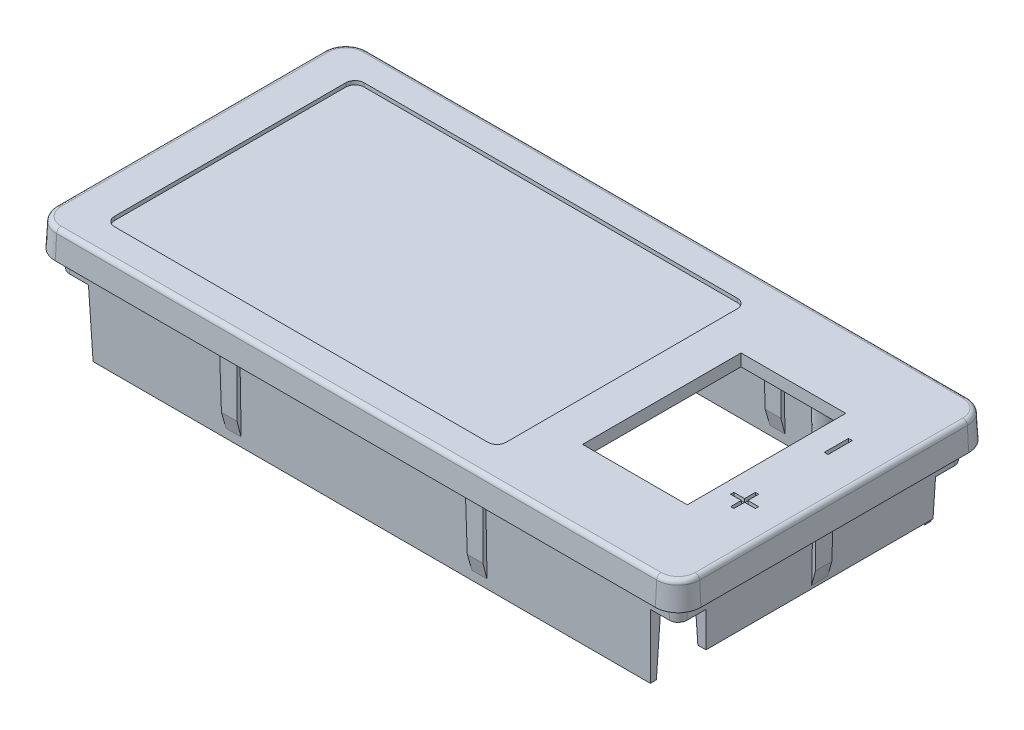
from build123d import *

# Parameters (mm, degrees)
BOSS_EXTRUDE1_DEPTH           = 3
BOSS_EXTRUDE1_TAPER           = 3
FILLET1_R                     = 0.5
CUT_EXTRUDE1_DEPTH            = 0.5
BOSS_EXTRUDE2_DEPTH           = 9.8
BOSS_EXTRUDE2_DRAFT           = 2
CUT_EXTRUDE2_DEPTH            = 1.2
CUT_EXTRUDE2_DRAFT            = -2
SKETCH7_W                     = 80
SKETCH7_H                     = 26.5
CUT_EXTRUDE3_DEPTH            = 3.3
SKETCH6_W                     = 5.700947067
SKETCH6_H                     = 5.700947067
CUT_EXTRUDE4_DEPTH            = 7.3
CUT_EXTRUDE4_DRAFT            = -2
CUT_EXTRUDE4_PROFILE_2_DEPTH  = 7.3
CUT_EXTRUDE4_PROFILE_2_DRAFT  = -2
CUT_EXTRUDE4_PROFILE_3_DEPTH  = 7.3
CUT_EXTRUDE4_PROFILE_3_DRAFT  = -2
CUT_EXTRUDE4_PROFILE_4_DEPTH  = 7.3
CUT_EXTRUDE4_PROFILE_4_DRAFT  = -2
SKETCH8_W                     = 32
SKETCH8_H                     = 2
CUT_EXTRUDE5_DEPTH            = 7.3
FILLET3_R                     = 0.5
SKETCH9_R                     = 1.5
SKETCH9_R_2                   = 0.8
BOSS_EXTRUDE3_DEPTH           = 0.6
BOSS_EXTRUDE3_DRAFT           = 2
BOSS_EXTRUDE3_PROFILE_2_DEPTH = 0.6
BOSS_EXTRUDE3_PROFILE_2_DRAFT = 2
BOSS_EXTRUDE3_PROFILE_3_DEPTH = 0.6
BOSS_EXTRUDE3_PROFILE_3_DRAFT = 2
BOSS_EXTRUDE3_PROFILE_4_DEPTH = 0.6
BOSS_EXTRUDE3_PROFILE_4_DRAFT = 2
SKETCH10_R                    = 1.75
BOSS_EXTRUDE4_DEPTH           = 1
BOSS_EXTRUDE4_DRAFT           = 2
BOSS_EXTRUDE4_PROFILE_2_DEPTH = 1
BOSS_EXTRUDE4_PROFILE_2_DRAFT = 2
BOSS_EXTRUDE4_PROFILE_3_DEPTH = 1
BOSS_EXTRUDE4_PROFILE_3_DRAFT = 2
SKETCH11_R                    = 1.25
SKETCH11_R_2                  = 0.55
BOSS_EXTRUDE5_DEPTH           = 6
BOSS_EXTRUDE5_DRAFT           = 1
BOSS_EXTRUDE5_PROFILE_2_DEPTH = 6
BOSS_EXTRUDE5_PROFILE_2_DRAFT = 1
BOSS_EXTRUDE5_PROFILE_3_DEPTH = 6
BOSS_EXTRUDE5_PROFILE_3_DRAFT = 1
SKETCH12_W                    = 11.5
SKETCH12_H                    = 17.4
CUT_EXTRUDE6_DEPTH            = 42.277506108
CUT_EXTRUDE6_DRAFT            = -1
CUT_EXTRUDE7_DEPTH            = 0.4
CUT_EXTRUDE7_DRAFT            = -2
CUT_EXTRUDE8_DEPTH            = 0.4
CUT_EXTRUDE8_DRAFT            = -1
SKETCH14_W                    = 0.41025641
SKETCH14_H                    = 2.666666666
CUT_EXTRUDE8_PROFILE_2_DEPTH  = 0.4
CUT_EXTRUDE8_PROFILE_2_DRAFT  = -1
SKETCH16_W                    = 2
SKETCH16_H                    = 2
BOSS_EXTRUDE7_DEPTH           = 10
BOSS_EXTRUDE7_DRAFT           = 1
BOSS_EXTRUDE7_PROFILE_2_DEPTH = 10
BOSS_EXTRUDE7_PROFILE_2_DRAFT = 1
BOSS_EXTRUDE7_PROFILE_3_DEPTH = 10
BOSS_EXTRUDE7_PROFILE_3_DRAFT = 1
BOSS_EXTRUDE7_PROFILE_4_DEPTH = 10
BOSS_EXTRUDE7_PROFILE_4_DRAFT = 1
SKETCH17_W                    = 1
SKETCH17_H                    = 2
BOSS_EXTRUDE8_DEPTH           = 7.5
BOSS_EXTRUDE8_DRAFT           = 1
BOSS_EXTRUDE8_PROFILE_2_DEPTH = 7.5
BOSS_EXTRUDE8_PROFILE_2_DRAFT = 1
BOSS_EXTRUDE8_PROFILE_3_DEPTH = 7.5
BOSS_EXTRUDE8_PROFILE_3_DRAFT = 1
CHAMFER1_SIZE                 = 0.45
CHAMFER1_SIZE_2               = 1.75


with BuildPart() as part:
    # Sketch1 → Boss-Extrude1 (new body)
    with BuildSketch(Plane(origin=(0, 0, 0), x_dir=(1, 0, 0), z_dir=(0, 1, 0))):
        with BuildLine():
            Line((-32.95, -17.2), (32.95, -17.2))
            ThreePointArc((32.95, -17.2), (34.717766953, -16.467766953), (35.45, -14.7))
            Line((35.45, -14.7), (35.45, 14.7))
            ThreePointArc((35.45, 14.7), (34.717766953, 16.467766953), (32.95, 17.2))
            Line((32.95, 17.2), (-32.95, 17.2))
            ThreePointArc((-32.95, 17.2), (-34.717766953, 16.467766953), (-35.45, 14.7))
            Line((-35.45, 14.7), (-35.45, -14.7))
            ThreePointArc((-35.45, -14.7), (-34.717766953, -16.467766953), (-32.95, -17.2))
        make_face()
    extrude(amount=BOSS_EXTRUDE1_DEPTH, taper=BOSS_EXTRUDE1_TAPER)

    # Fillet1
    fillet1_edges = [part.edges().sort_by_distance(p)[0] for p in [
        (34.606593265, 3, -16.356593265),
        (0, 3, -17.042776662),
        (-34.606593265, 3, -16.356593265),
        (-35.292776662, 3, 0),
        (-34.606593265, 3, 16.356593265),
        (0, 3, 17.042776662),
        (34.606593265, 3, 16.356593265),
        (35.292776662, 3, 0),
    ]]
    fillet(fillet1_edges, radius=FILLET1_R)

    # Sketch2 → Cut-Extrude1 (cut)
    with BuildSketch(Plane.XZ):
        with BuildLine():
            Line((32.95, 16.45), (-32.95, 16.45))
            ThreePointArc((-32.95, 16.45), (-34.187436867, 15.937436867), (-34.7, 14.7))
            Line((-34.7, 14.7), (-34.7, -14.7))
            ThreePointArc((-34.7, -14.7), (-34.187436867, -15.937436867), (-32.95, -16.45))
            Line((-32.95, -16.45), (32.95, -16.45))
            ThreePointArc((32.95, -16.45), (34.187436867, -15.937436867), (34.7, -14.7))
            Line((34.7, -14.7), (34.7, 14.7))
            ThreePointArc((34.7, 14.7), (34.187436867, 15.937436867), (32.95, 16.45))
        make_face()
    extrude(amount=-CUT_EXTRUDE1_DEPTH, mode=Mode.SUBTRACT)


with BuildPart() as boss_extrude2_tool:
    # Sketch4 → Boss-Extrude2 (with draft: the straight prism first)
    with BuildSketch(Plane.XZ.offset(-0.5)):
        with BuildLine():
            Line((32.95, 15.75), (-32.95, 15.75))
            ThreePointArc((-32.95, 15.75), (-33.69246212, 15.44246212), (-34, 14.7))
            Line((-34, 14.7), (-34, -14.7))
            ThreePointArc((-34, -14.7), (-33.69246212, -15.44246212), (-32.95, -15.75))
            Line((-32.95, -15.75), (32.95, -15.75))
            ThreePointArc((32.95, -15.75), (33.69246212, -15.44246212), (34, -14.7))
            Line((34, -14.7), (34, 14.7))
            ThreePointArc((34, 14.7), (33.69246212, 15.44246212), (32.95, 15.75))
        make_face()
        with BuildLine():
            Line((31.65, -14.4), (-31.65, -14.4))
            ThreePointArc((-31.65, -14.4), (-32.357106781, -14.107106781), (-32.65, -13.4))
            Line((-32.65, -13.4), (-32.65, 13.4))
            ThreePointArc((-32.65, 13.4), (-32.357106781, 14.107106781), (-31.65, 14.4))
            Line((-31.65, 14.4), (31.65, 14.4))
            ThreePointArc((31.65, 14.4), (32.357106781, 14.107106781), (32.65, 13.4))
            Line((32.65, 13.4), (32.65, -13.4))
            ThreePointArc((32.65, -13.4), (32.357106781, -14.107106781), (31.65, -14.4))
        make_face(mode=Mode.SUBTRACT)
    extrude(amount=BOSS_EXTRUDE2_DEPTH)
    # Boss-Extrude2: the draft: its side faces are tilted about the plane it starts from
    boss_extrude2_sides = [boss_extrude2_tool.faces().sort_by_distance(p)[0] for p in [
        (0, -4.4, 15.75),
        (-33.69246212, -4.4, 15.44246212),
        (-34, -4.4, 0),
        (-33.69246212, -4.4, -15.44246212),
        (0, -4.4, -15.75),
        (33.69246212, -4.4, -15.44246212),
        (34, -4.4, 0),
        (33.69246212, -4.4, 15.44246212),
        (0, -4.4, -14.4),
        (-32.357106781, -4.4, -14.107106781),
        (-32.65, -4.4, 0),
        (-32.357106781, -4.4, 14.107106781),
        (0, -4.4, 14.4),
        (32.357106781, -4.4, 14.107106781),
        (32.65, -4.4, 0),
        (32.357106781, -4.4, -14.107106781),
    ]]
    draft(boss_extrude2_sides, Plane.XZ.offset(-0.5), BOSS_EXTRUDE2_DRAFT)


with BuildPart() as part_1:
    add(part.part)

    # Boss-Extrude2: add boss_extrude2_tool
    add(boss_extrude2_tool.part)


with BuildPart() as cut_extrude2_tool:
    # Sketch5 → Cut-Extrude2 (with draft: the straight prism first)
    with BuildSketch(Plane.XZ.offset(-0.5)):
        with BuildLine():
            Line((31.65, 14.4), (-31.65, 14.4))
            ThreePointArc((-31.65, 14.4), (-32.357106781, 14.107106781), (-32.65, 13.4))
            Line((-32.65, 13.4), (-32.65, -13.4))
            ThreePointArc((-32.65, -13.4), (-32.357106781, -14.107106781), (-31.65, -14.4))
            Line((-31.65, -14.4), (31.65, -14.4))
            ThreePointArc((31.65, -14.4), (32.357106781, -14.107106781), (32.65, -13.4))
            Line((32.65, -13.4), (32.65, 13.4))
            ThreePointArc((32.65, 13.4), (32.357106781, 14.107106781), (31.65, 14.4))
        make_face()
    extrude(amount=-CUT_EXTRUDE2_DEPTH)
    # Cut-Extrude2: the draft: its side faces are tilted about the plane it starts from
    cut_extrude2_sides = [cut_extrude2_tool.faces().sort_by_distance(p)[0] for p in [
        (0, 1.1, 14.4),
        (-32.357106781, 1.1, 14.107106781),
        (-32.65, 1.1, 0),
        (-32.357106781, 1.1, -14.107106781),
        (0, 1.1, -14.4),
        (32.357106781, 1.1, -14.107106781),
        (32.65, 1.1, 0),
        (32.357106781, 1.1, 14.107106781),
    ]]
    draft(cut_extrude2_sides, Plane.XZ.offset(-0.5), CUT_EXTRUDE2_DRAFT)


with BuildPart() as part_2:
    add(part_1.part)

    # Cut-Extrude2: cut by cut_extrude2_tool
    add(cut_extrude2_tool.part, mode=Mode.SUBTRACT)

    # Sketch7 → Cut-Extrude3 (cut)
    with BuildSketch(Plane.XZ.offset(9.3)):
        Rectangle(SKETCH7_W, SKETCH7_H)
    extrude(amount=-CUT_EXTRUDE3_DEPTH, mode=Mode.SUBTRACT)


with BuildPart() as cut_extrude4_tool:
    # Sketch6 → Cut-Extrude4 (with draft: the straight prism first)
    with BuildSketch(Plane.XZ.offset(9.3)):
        with Locations((-33.450473534, 15.200473534)):
            Rectangle(SKETCH6_W, SKETCH6_H)
    extrude(amount=-CUT_EXTRUDE4_DEPTH)
    # Cut-Extrude4: the draft: its side faces are tilted about the plane it starts from
    cut_extrude4_sides = [cut_extrude4_tool.faces().sort_by_distance(p)[0] for p in [
        (-36.300947067, -5.65, 15.200473534),
        (-33.450473534, -5.65, 12.35),
        (-30.6, -5.65, 15.200473534),
        (-33.450473534, -5.65, 18.050947067),
    ]]
    draft(cut_extrude4_sides, Plane.XZ.offset(9.3), CUT_EXTRUDE4_DRAFT)


with BuildPart() as part_3:
    add(part_2.part)

    # Cut-Extrude4: cut by cut_extrude4_tool
    add(cut_extrude4_tool.part, mode=Mode.SUBTRACT)


with BuildPart() as cut_extrude4_profile_2_tool:
    # Sketch6 → Cut-Extrude4 profile 2 (with draft: the straight prism first)
    with BuildSketch(Plane.XZ.offset(9.3)):
        with Locations((33.450473534, 15.200473534)):
            Rectangle(SKETCH6_W, SKETCH6_H)
    extrude(amount=-CUT_EXTRUDE4_PROFILE_2_DEPTH)
    # Cut-Extrude4 profile 2: the draft: its side faces are tilted about the plane it starts from
    cut_extrude4_profile_2_sides = [cut_extrude4_profile_2_tool.faces().sort_by_distance(p)[0] for p in [
        (30.6, -5.65, 15.200473534),
        (33.450473534, -5.65, 12.35),
        (36.300947067, -5.65, 15.200473534),
        (33.450473534, -5.65, 18.050947067),
    ]]
    draft(cut_extrude4_profile_2_sides, Plane.XZ.offset(9.3), CUT_EXTRUDE4_PROFILE_2_DRAFT)


with BuildPart() as part_4:
    add(part_3.part)

    # Cut-Extrude4 profile 2: cut by cut_extrude4_profile_2_tool
    add(cut_extrude4_profile_2_tool.part, mode=Mode.SUBTRACT)


with BuildPart() as cut_extrude4_profile_3_tool:
    # Sketch6 → Cut-Extrude4 profile 3 (with draft: the straight prism first)
    with BuildSketch(Plane.XZ.offset(9.3)):
        with Locations((33.450473534, -15.200473534)):
            Rectangle(SKETCH6_W, SKETCH6_H)
    extrude(amount=-CUT_EXTRUDE4_PROFILE_3_DEPTH)
    # Cut-Extrude4 profile 3: the draft: its side faces are tilted about the plane it starts from
    cut_extrude4_profile_3_sides = [cut_extrude4_profile_3_tool.faces().sort_by_distance(p)[0] for p in [
        (36.300947067, -5.65, -15.200473534),
        (33.450473534, -5.65, -12.35),
        (30.6, -5.65, -15.200473534),
        (33.450473534, -5.65, -18.050947067),
    ]]
    draft(cut_extrude4_profile_3_sides, Plane.XZ.offset(9.3), CUT_EXTRUDE4_PROFILE_3_DRAFT)


with BuildPart() as part_5:
    add(part_4.part)

    # Cut-Extrude4 profile 3: cut by cut_extrude4_profile_3_tool
    add(cut_extrude4_profile_3_tool.part, mode=Mode.SUBTRACT)


with BuildPart() as cut_extrude4_profile_4_tool:
    # Sketch6 → Cut-Extrude4 profile 4 (with draft: the straight prism first)
    with BuildSketch(Plane.XZ.offset(9.3)):
        with Locations((-33.450473534, -15.200473534)):
            Rectangle(SKETCH6_W, SKETCH6_H)
    extrude(amount=-CUT_EXTRUDE4_PROFILE_4_DEPTH)
    # Cut-Extrude4 profile 4: the draft: its side faces are tilted about the plane it starts from
    cut_extrude4_profile_4_sides = [cut_extrude4_profile_4_tool.faces().sort_by_distance(p)[0] for p in [
        (-30.6, -5.65, -15.200473534),
        (-33.450473534, -5.65, -12.35),
        (-36.300947067, -5.65, -15.200473534),
        (-33.450473534, -5.65, -18.050947067),
    ]]
    draft(cut_extrude4_profile_4_sides, Plane.XZ.offset(9.3), CUT_EXTRUDE4_PROFILE_4_DRAFT)


with BuildPart() as part_6:
    add(part_5.part)

    # Cut-Extrude4 profile 4: cut by cut_extrude4_profile_4_tool
    add(cut_extrude4_profile_4_tool.part, mode=Mode.SUBTRACT)

    # Sketch8 → Cut-Extrude5 (cut)
    with BuildSketch(Plane.XZ.offset(9.3)):
        with Locations((-10.8, -15.072223541)):
            Rectangle(SKETCH8_W, SKETCH8_H)
    extrude(amount=-CUT_EXTRUDE5_DEPTH, mode=Mode.SUBTRACT)

    # Fillet3
    fillet3_edges = [part_6.edges().sort_by_distance(p)[0] for p in [
        (32.327475526, 1.7, 14.077475526),
        (32.608095077, 1.7, 0),
        (32.327475526, 1.7, -14.077475526),
        (0, 1.7, -14.358095077),
        (-32.327475526, 1.7, -14.077475526),
        (-32.608095077, 1.7, 0),
        (-32.327475526, 1.7, 14.077475526),
        (0, 1.7, 14.358095077),
    ]]
    fillet(fillet3_edges, radius=FILLET3_R)


with BuildPart() as boss_extrude3_tool:
    # Sketch9 → Boss-Extrude3 (with draft: the straight prism first)
    with BuildSketch(Plane.XZ.offset(-1.7)):
        with Locations((-30.625250689, 12.375250689)):
            Circle(SKETCH9_R)
        with Locations((-30.625250689, 12.375250689)):
            Circle(SKETCH9_R_2, mode=Mode.SUBTRACT)
    extrude(amount=BOSS_EXTRUDE3_DEPTH)
    # Boss-Extrude3: the draft: its side faces are tilted about the plane it starts from
    boss_extrude3_sides = [boss_extrude3_tool.faces().sort_by_distance(p)[0] for p in [
        (-32.125250689, 1.4, 12.375250689),
        (-31.425250689, 1.4, 12.375250689),
    ]]
    draft(boss_extrude3_sides, Plane.XZ.offset(-1.7), BOSS_EXTRUDE3_DRAFT)


with BuildPart() as part_7:
    add(part_6.part)

    # Boss-Extrude3: add boss_extrude3_tool
    add(boss_extrude3_tool.part)


with BuildPart() as boss_extrude3_profile_2_tool:
    # Sketch9 → Boss-Extrude3 profile 2 (with draft: the straight prism first)
    with BuildSketch(Plane.XZ.offset(-1.7)):
        with Locations((30.625250689, 12.375250689)):
            Circle(SKETCH9_R)
        with Locations((30.625250689, 12.375250689)):
            Circle(SKETCH9_R_2, mode=Mode.SUBTRACT)
    extrude(amount=BOSS_EXTRUDE3_PROFILE_2_DEPTH)
    # Boss-Extrude3 profile 2: the draft: its side faces are tilted about the plane it starts from
    boss_extrude3_profile_2_sides = [boss_extrude3_profile_2_tool.faces().sort_by_distance(p)[0] for p in [
        (29.125250689, 1.4, 12.375250689),
        (29.825250689, 1.4, 12.375250689),
    ]]
    draft(boss_extrude3_profile_2_sides, Plane.XZ.offset(-1.7), BOSS_EXTRUDE3_PROFILE_2_DRAFT)


with BuildPart() as part_8:
    add(part_7.part)

    # Boss-Extrude3 profile 2: add boss_extrude3_profile_2_tool
    add(boss_extrude3_profile_2_tool.part)


with BuildPart() as boss_extrude3_profile_3_tool:
    # Sketch9 → Boss-Extrude3 profile 3 (with draft: the straight prism first)
    with BuildSketch(Plane.XZ.offset(-1.7)):
        with Locations((30.625250689, -12.375250689)):
            Circle(SKETCH9_R)
        with Locations((30.625250689, -12.375250689)):
            Circle(SKETCH9_R_2, mode=Mode.SUBTRACT)
    extrude(amount=BOSS_EXTRUDE3_PROFILE_3_DEPTH)
    # Boss-Extrude3 profile 3: the draft: its side faces are tilted about the plane it starts from
    boss_extrude3_profile_3_sides = [boss_extrude3_profile_3_tool.faces().sort_by_distance(p)[0] for p in [
        (29.125250689, 1.4, -12.375250689),
        (29.825250689, 1.4, -12.375250689),
    ]]
    draft(boss_extrude3_profile_3_sides, Plane.XZ.offset(-1.7), BOSS_EXTRUDE3_PROFILE_3_DRAFT)


with BuildPart() as part_9:
    add(part_8.part)

    # Boss-Extrude3 profile 3: add boss_extrude3_profile_3_tool
    add(boss_extrude3_profile_3_tool.part)


with BuildPart() as boss_extrude3_profile_4_tool:
    # Sketch9 → Boss-Extrude3 profile 4 (with draft: the straight prism first)
    with BuildSketch(Plane.XZ.offset(-1.7)):
        with Locations((-30.625250689, -12.375250689)):
            Circle(SKETCH9_R)
        with Locations((-30.625250689, -12.375250689)):
            Circle(SKETCH9_R_2, mode=Mode.SUBTRACT)
    extrude(amount=BOSS_EXTRUDE3_PROFILE_4_DEPTH)
    # Boss-Extrude3 profile 4: the draft: its side faces are tilted about the plane it starts from
    boss_extrude3_profile_4_sides = [boss_extrude3_profile_4_tool.faces().sort_by_distance(p)[0] for p in [
        (-32.125250689, 1.4, -12.375250689),
        (-31.425250689, 1.4, -12.375250689),
    ]]
    draft(boss_extrude3_profile_4_sides, Plane.XZ.offset(-1.7), BOSS_EXTRUDE3_PROFILE_4_DRAFT)


with BuildPart() as part_10:
    add(part_9.part)

    # Boss-Extrude3 profile 4: add boss_extrude3_profile_4_tool
    add(boss_extrude3_profile_4_tool.part)


with BuildPart() as boss_extrude4_tool:
    # Sketch10 → Boss-Extrude4 (with draft: the straight prism first)
    with BuildSketch(Plane.XZ.offset(-1.7)):
        with Locations((21.95, 12.624946103)):
            Circle(SKETCH10_R)
    extrude(amount=BOSS_EXTRUDE4_DEPTH)
    # Boss-Extrude4: the draft: its side faces are tilted about the plane it starts from
    boss_extrude4_sides = [boss_extrude4_tool.faces().sort_by_distance(p)[0] for p in [
        (20.2, 1.2, 12.624946103),
    ]]
    draft(boss_extrude4_sides, Plane.XZ.offset(-1.7), BOSS_EXTRUDE4_DRAFT)


with BuildPart() as part_11:
    add(part_10.part)

    # Boss-Extrude4: add boss_extrude4_tool
    add(boss_extrude4_tool.part)


with BuildPart() as boss_extrude4_profile_2_tool:
    # Sketch10 → Boss-Extrude4 profile 2 (with draft: the straight prism first)
    with BuildSketch(Plane.XZ.offset(-1.7)):
        with Locations((21.95, -12.624946103)):
            Circle(SKETCH10_R)
    extrude(amount=BOSS_EXTRUDE4_PROFILE_2_DEPTH)
    # Boss-Extrude4 profile 2: the draft: its side faces are tilted about the plane it starts from
    boss_extrude4_profile_2_sides = [boss_extrude4_profile_2_tool.faces().sort_by_distance(p)[0] for p in [
        (20.2, 1.2, -12.624946103),
    ]]
    draft(boss_extrude4_profile_2_sides, Plane.XZ.offset(-1.7), BOSS_EXTRUDE4_PROFILE_2_DRAFT)


with BuildPart() as part_12:
    add(part_11.part)

    # Boss-Extrude4 profile 2: add boss_extrude4_profile_2_tool
    add(boss_extrude4_profile_2_tool.part)


with BuildPart() as boss_extrude4_profile_3_tool:
    # Sketch10 → Boss-Extrude4 profile 3 (with draft: the straight prism first)
    with BuildSketch(Plane.XZ.offset(-1.7)):
        with Locations((-30.874946103, 0)):
            Circle(SKETCH10_R)
    extrude(amount=BOSS_EXTRUDE4_PROFILE_3_DEPTH)
    # Boss-Extrude4 profile 3: the draft: its side faces are tilted about the plane it starts from
    boss_extrude4_profile_3_sides = [boss_extrude4_profile_3_tool.faces().sort_by_distance(p)[0] for p in [
        (-32.624946103, 1.2, 0),
    ]]
    draft(boss_extrude4_profile_3_sides, Plane.XZ.offset(-1.7), BOSS_EXTRUDE4_PROFILE_3_DRAFT)


with BuildPart() as part_13:
    add(part_12.part)

    # Boss-Extrude4 profile 3: add boss_extrude4_profile_3_tool
    add(boss_extrude4_profile_3_tool.part)


with BuildPart() as boss_extrude5_tool:
    # Sketch11 → Boss-Extrude5 (with draft: the straight prism first)
    with BuildSketch(Plane.XZ.offset(-1.7)):
        with Locations((21.95, 12.624946103)):
            Circle(SKETCH11_R)
        with Locations((21.95, 12.624946103)):
            Circle(SKETCH11_R_2, mode=Mode.SUBTRACT)
    extrude(amount=BOSS_EXTRUDE5_DEPTH)
    # Boss-Extrude5: the draft: its side faces are tilted about the plane it starts from
    boss_extrude5_sides = [boss_extrude5_tool.faces().sort_by_distance(p)[0] for p in [
        (20.7, -1.3, 12.624946103),
        (21.4, -1.3, 12.624946103),
    ]]
    draft(boss_extrude5_sides, Plane.XZ.offset(-1.7), BOSS_EXTRUDE5_DRAFT)


with BuildPart() as part_14:
    add(part_13.part)

    # Boss-Extrude5: add boss_extrude5_tool
    add(boss_extrude5_tool.part)


with BuildPart() as boss_extrude5_profile_2_tool:
    # Sketch11 → Boss-Extrude5 profile 2 (with draft: the straight prism first)
    with BuildSketch(Plane.XZ.offset(-1.7)):
        with Locations((21.95, -12.624946103)):
            Circle(SKETCH11_R)
        with Locations((21.95, -12.624946103)):
            Circle(SKETCH11_R_2, mode=Mode.SUBTRACT)
    extrude(amount=BOSS_EXTRUDE5_PROFILE_2_DEPTH)
    # Boss-Extrude5 profile 2: the draft: its side faces are tilted about the plane it starts from
    boss_extrude5_profile_2_sides = [boss_extrude5_profile_2_tool.faces().sort_by_distance(p)[0] for p in [
        (20.7, -1.3, -12.624946103),
        (21.4, -1.3, -12.624946103),
    ]]
    draft(boss_extrude5_profile_2_sides, Plane.XZ.offset(-1.7), BOSS_EXTRUDE5_PROFILE_2_DRAFT)


with BuildPart() as part_15:
    add(part_14.part)

    # Boss-Extrude5 profile 2: add boss_extrude5_profile_2_tool
    add(boss_extrude5_profile_2_tool.part)


with BuildPart() as boss_extrude5_profile_3_tool:
    # Sketch11 → Boss-Extrude5 profile 3 (with draft: the straight prism first)
    with BuildSketch(Plane.XZ.offset(-1.7)):
        with Locations((-30.874946103, 0)):
            Circle(SKETCH11_R)
        with Locations((-30.874946103, 0)):
            Circle(SKETCH11_R_2, mode=Mode.SUBTRACT)
    extrude(amount=BOSS_EXTRUDE5_PROFILE_3_DEPTH)
    # Boss-Extrude5 profile 3: the draft: its side faces are tilted about the plane it starts from
    boss_extrude5_profile_3_sides = [boss_extrude5_profile_3_tool.faces().sort_by_distance(p)[0] for p in [
        (-32.124946103, -1.3, 0),
        (-31.424946103, -1.3, 0),
    ]]
    draft(boss_extrude5_profile_3_sides, Plane.XZ.offset(-1.7), BOSS_EXTRUDE5_PROFILE_3_DRAFT)


with BuildPart() as part_16:
    add(part_15.part)

    # Boss-Extrude5 profile 3: add boss_extrude5_profile_3_tool
    add(boss_extrude5_profile_3_tool.part)


with BuildPart() as cut_extrude6_tool:
    # Sketch12 → Cut-Extrude6 (with draft: the straight prism first)
    with BuildSketch(Plane(origin=(0, 3, 0), x_dir=(1, 0, 0), z_dir=(0, 1, 0))):
        with Locations((22.2, 0)):
            Rectangle(SKETCH12_W, SKETCH12_H)
    extrude(amount=-CUT_EXTRUDE6_DEPTH)
    # Cut-Extrude6: the draft: its side faces are tilted about the plane it starts from
    cut_extrude6_sides = [cut_extrude6_tool.faces().sort_by_distance(p)[0] for p in [
        (22.2, -18.138753054, 8.7),
        (27.95, -18.138753054, 0),
        (22.2, -18.138753054, -8.7),
        (16.45, -18.138753054, 0),
    ]]
    draft(cut_extrude6_sides, Plane(origin=(0, 3, 0), x_dir=(1, 0, 0), z_dir=(0, 1, 0)), CUT_EXTRUDE6_DRAFT)


with BuildPart() as part_17:
    add(part_16.part)

    # Cut-Extrude6: cut by cut_extrude6_tool
    add(cut_extrude6_tool.part, mode=Mode.SUBTRACT)


with BuildPart() as cut_extrude7_tool:
    # Sketch13 → Cut-Extrude7 (with draft: the straight prism first)
    with BuildSketch(Plane(origin=(0, 3, 0), x_dir=(1, 0, 0), z_dir=(0, 1, 0))):
        with BuildLine():
            Line((-29.95, -13.7), (11.05, -13.7))
            ThreePointArc((11.05, -13.7), (11.757106781, -13.407106781), (12.05, -12.7))
            Line((12.05, -12.7), (12.05, 12.7))
            ThreePointArc((12.05, 12.7), (11.757106781, 13.407106781), (11.05, 13.7))
            Line((11.05, 13.7), (-29.95, 13.7))
            ThreePointArc((-29.95, 13.7), (-30.657106781, 13.407106781), (-30.95, 12.7))
            Line((-30.95, 12.7), (-30.95, -12.7))
            ThreePointArc((-30.95, -12.7), (-30.657106781, -13.407106781), (-29.95, -13.7))
        make_face()
    extrude(amount=-CUT_EXTRUDE7_DEPTH)
    # Cut-Extrude7: the draft: its side faces are tilted about the plane it starts from
    cut_extrude7_sides = [cut_extrude7_tool.faces().sort_by_distance(p)[0] for p in [
        (-9.45, 2.8, 13.7),
        (11.757106781, 2.8, 13.407106781),
        (12.05, 2.8, 0),
        (11.757106781, 2.8, -13.407106781),
        (-9.45, 2.8, -13.7),
        (-30.657106781, 2.8, -13.407106781),
        (-30.95, 2.8, 0),
        (-30.657106781, 2.8, 13.407106781),
    ]]
    draft(cut_extrude7_sides, Plane(origin=(0, 3, 0), x_dir=(1, 0, 0), z_dir=(0, 1, 0)), CUT_EXTRUDE7_DRAFT)


with BuildPart() as part_18:
    add(part_17.part)

    # Cut-Extrude7: cut by cut_extrude7_tool
    add(cut_extrude7_tool.part, mode=Mode.SUBTRACT)


with BuildPart() as cut_extrude8_tool:
    # Sketch14 → Cut-Extrude8 (with draft: the straight prism first)
    with BuildSketch(Plane(origin=(0, 3, 0), x_dir=(1, 0, 0), z_dir=(0, 1, 0))):
        Polygon((30.501865276, -4.954313792), (29.322378096, -4.954313792), (29.322378096, -5.313288151), (30.501865276, -5.313288151), (30.501865276, -6.49277533), (30.860839635, -6.49277533), (30.860839635, -5.313288151), (32.040326814, -5.313288151), (32.040326814, -4.954313792), (30.860839635, -4.954313792), (30.860839635, -3.774826612), (30.501865276, -3.774826612), align=None)
    extrude(amount=-CUT_EXTRUDE8_DEPTH)
    # Cut-Extrude8: the draft: its side faces are tilted about the plane it starts from
    cut_extrude8_sides = [cut_extrude8_tool.faces().sort_by_distance(p)[0] for p in [
        (29.912121686, 2.8, 4.954313792),
        (29.322378096, 2.8, 5.133800971),
        (29.912121686, 2.8, 5.313288151),
        (30.501865276, 2.8, 5.903031741),
        (30.681352455, 2.8, 6.49277533),
        (30.860839635, 2.8, 5.903031741),
        (31.450583224, 2.8, 5.313288151),
        (32.040326814, 2.8, 5.133800971),
        (31.450583224, 2.8, 4.954313792),
        (30.860839635, 2.8, 4.364570202),
        (30.681352455, 2.8, 3.774826612),
        (30.501865276, 2.8, 4.364570202),
    ]]
    draft(cut_extrude8_sides, Plane(origin=(0, 3, 0), x_dir=(1, 0, 0), z_dir=(0, 1, 0)), CUT_EXTRUDE8_DRAFT)


with BuildPart() as part_19:
    add(part_18.part)

    # Cut-Extrude8: cut by cut_extrude8_tool
    add(cut_extrude8_tool.part, mode=Mode.SUBTRACT)


with BuildPart() as cut_extrude8_profile_2_tool:
    # Sketch14 → Cut-Extrude8 profile 2 (with draft: the straight prism first)
    with BuildSketch(Plane(origin=(0, 3, 0), x_dir=(1, 0, 0), z_dir=(0, 1, 0))):
        with Locations((30.688940897, 5.144663609)):
            Rectangle(SKETCH14_W, SKETCH14_H)
    extrude(amount=-CUT_EXTRUDE8_PROFILE_2_DEPTH)
    # Cut-Extrude8 profile 2: the draft: its side faces are tilted about the plane it starts from
    cut_extrude8_profile_2_sides = [cut_extrude8_profile_2_tool.faces().sort_by_distance(p)[0] for p in [
        (30.483812692, 2.8, -5.144663609),
        (30.688940897, 2.8, -3.811330276),
        (30.894069102, 2.8, -5.144663609),
        (30.688940897, 2.8, -6.477996942),
    ]]
    draft(cut_extrude8_profile_2_sides, Plane(origin=(0, 3, 0), x_dir=(1, 0, 0), z_dir=(0, 1, 0)), CUT_EXTRUDE8_PROFILE_2_DRAFT)


with BuildPart() as part_20:
    add(part_19.part)

    # Cut-Extrude8 profile 2: cut by cut_extrude8_profile_2_tool
    add(cut_extrude8_profile_2_tool.part, mode=Mode.SUBTRACT)


with BuildPart() as boss_extrude7_tool:
    # Sketch16 → Boss-Extrude7 (with draft: the straight prism first)
    with BuildSketch(Plane.XZ.offset(-1.7)):
        with Locations((-15.125250689, 15.075)):
            Rectangle(SKETCH16_W, SKETCH16_H)
    extrude(amount=BOSS_EXTRUDE7_DEPTH)
    # Boss-Extrude7: the draft: its side faces are tilted about the plane it starts from
    boss_extrude7_sides = [boss_extrude7_tool.faces().sort_by_distance(p)[0] for p in [
        (-15.125250689, -3.3, 14.075),
        (-14.125250689, -3.3, 15.075),
        (-15.125250689, -3.3, 16.075),
        (-16.125250689, -3.3, 15.075),
    ]]
    draft(boss_extrude7_sides, Plane.XZ.offset(-1.7), BOSS_EXTRUDE7_DRAFT)


with BuildPart() as part_21:
    add(part_20.part)

    # Boss-Extrude7: add boss_extrude7_tool
    add(boss_extrude7_tool.part)


with BuildPart() as boss_extrude7_profile_2_tool:
    # Sketch16 → Boss-Extrude7 profile 2 (with draft: the straight prism first)
    with BuildSketch(Plane.XZ.offset(-1.7)):
        with Locations((11.874749311, 15.075)):
            Rectangle(SKETCH16_W, SKETCH16_H)
    extrude(amount=BOSS_EXTRUDE7_PROFILE_2_DEPTH)
    # Boss-Extrude7 profile 2: the draft: its side faces are tilted about the plane it starts from
    boss_extrude7_profile_2_sides = [boss_extrude7_profile_2_tool.faces().sort_by_distance(p)[0] for p in [
        (11.874749311, -3.3, 14.075),
        (12.874749311, -3.3, 15.075),
        (11.874749311, -3.3, 16.075),
        (10.874749311, -3.3, 15.075),
    ]]
    draft(boss_extrude7_profile_2_sides, Plane.XZ.offset(-1.7), BOSS_EXTRUDE7_PROFILE_2_DRAFT)


with BuildPart() as part_22:
    add(part_21.part)

    # Boss-Extrude7 profile 2: add boss_extrude7_profile_2_tool
    add(boss_extrude7_profile_2_tool.part)


with BuildPart() as boss_extrude7_profile_3_tool:
    # Sketch16 → Boss-Extrude7 profile 3 (with draft: the straight prism first)
    with BuildSketch(Plane.XZ.offset(-1.7)):
        with Locations((14.45, -15.075)):
            Rectangle(SKETCH16_W, SKETCH16_H)
    extrude(amount=BOSS_EXTRUDE7_PROFILE_3_DEPTH)
    # Boss-Extrude7 profile 3: the draft: its side faces are tilted about the plane it starts from
    boss_extrude7_profile_3_sides = [boss_extrude7_profile_3_tool.faces().sort_by_distance(p)[0] for p in [
        (14.45, -3.3, -16.075),
        (15.45, -3.3, -15.075),
        (14.45, -3.3, -14.075),
        (13.45, -3.3, -15.075),
    ]]
    draft(boss_extrude7_profile_3_sides, Plane.XZ.offset(-1.7), BOSS_EXTRUDE7_PROFILE_3_DRAFT)


with BuildPart() as part_23:
    add(part_22.part)

    # Boss-Extrude7 profile 3: add boss_extrude7_profile_3_tool
    add(boss_extrude7_profile_3_tool.part)


with BuildPart() as boss_extrude7_profile_4_tool:
    # Sketch16 → Boss-Extrude7 profile 4 (with draft: the straight prism first)
    with BuildSketch(Plane.XZ.offset(-1.7)):
        with Locations((-28.7, -15.075)):
            Rectangle(SKETCH16_W, SKETCH16_H)
    extrude(amount=BOSS_EXTRUDE7_PROFILE_4_DEPTH)
    # Boss-Extrude7 profile 4: the draft: its side faces are tilted about the plane it starts from
    boss_extrude7_profile_4_sides = [boss_extrude7_profile_4_tool.faces().sort_by_distance(p)[0] for p in [
        (-28.7, -3.3, -16.075),
        (-27.7, -3.3, -15.075),
        (-28.7, -3.3, -14.075),
        (-29.7, -3.3, -15.075),
    ]]
    draft(boss_extrude7_profile_4_sides, Plane.XZ.offset(-1.7), BOSS_EXTRUDE7_PROFILE_4_DRAFT)


with BuildPart() as part_24:
    add(part_23.part)

    # Boss-Extrude7 profile 4: add boss_extrude7_profile_4_tool
    add(boss_extrude7_profile_4_tool.part)


with BuildPart() as boss_extrude8_tool:
    # Sketch17 → Boss-Extrude8 (with draft: the straight prism first)
    with BuildSketch(Plane.XZ.offset(-1.7)):
        with Locations((33.825, 0)):
            Rectangle(SKETCH17_W, SKETCH17_H)
    extrude(amount=BOSS_EXTRUDE8_DEPTH)
    # Boss-Extrude8: the draft: its side faces are tilted about the plane it starts from
    boss_extrude8_sides = [boss_extrude8_tool.faces().sort_by_distance(p)[0] for p in [
        (33.825, -2.05, -1),
        (34.325, -2.05, 0),
        (33.825, -2.05, 1),
        (33.325, -2.05, 0),
    ]]
    draft(boss_extrude8_sides, Plane.XZ.offset(-1.7), BOSS_EXTRUDE8_DRAFT)


with BuildPart() as part_25:
    add(part_24.part)

    # Boss-Extrude8: add boss_extrude8_tool
    add(boss_extrude8_tool.part)


with BuildPart() as boss_extrude8_profile_2_tool:
    # Sketch17 → Boss-Extrude8 profile 2 (with draft: the straight prism first)
    with BuildSketch(Plane.XZ.offset(-1.7)):
        with Locations((-33.825, 8.2)):
            Rectangle(SKETCH17_W, SKETCH17_H)
    extrude(amount=BOSS_EXTRUDE8_PROFILE_2_DEPTH)
    # Boss-Extrude8 profile 2: the draft: its side faces are tilted about the plane it starts from
    boss_extrude8_profile_2_sides = [boss_extrude8_profile_2_tool.faces().sort_by_distance(p)[0] for p in [
        (-33.825, -2.05, 9.2),
        (-34.325, -2.05, 8.2),
        (-33.825, -2.05, 7.2),
        (-33.325, -2.05, 8.2),
    ]]
    draft(boss_extrude8_profile_2_sides, Plane.XZ.offset(-1.7), BOSS_EXTRUDE8_PROFILE_2_DRAFT)


with BuildPart() as part_26:
    add(part_25.part)

    # Boss-Extrude8 profile 2: add boss_extrude8_profile_2_tool
    add(boss_extrude8_profile_2_tool.part)


with BuildPart() as boss_extrude8_profile_3_tool:
    # Sketch17 → Boss-Extrude8 profile 3 (with draft: the straight prism first)
    with BuildSketch(Plane.XZ.offset(-1.7)):
        with Locations((-33.825, -5.8)):
            Rectangle(SKETCH17_W, SKETCH17_H)
    extrude(amount=BOSS_EXTRUDE8_PROFILE_3_DEPTH)
    # Boss-Extrude8 profile 3: the draft: its side faces are tilted about the plane it starts from
    boss_extrude8_profile_3_sides = [boss_extrude8_profile_3_tool.faces().sort_by_distance(p)[0] for p in [
        (-33.825, -2.05, -4.8),
        (-34.325, -2.05, -5.8),
        (-33.825, -2.05, -6.8),
        (-33.325, -2.05, -5.8),
    ]]
    draft(boss_extrude8_profile_3_sides, Plane.XZ.offset(-1.7), BOSS_EXTRUDE8_PROFILE_3_DRAFT)


with BuildPart() as part_27:
    add(part_26.part)

    # Boss-Extrude8 profile 3: add boss_extrude8_profile_3_tool
    add(boss_extrude8_profile_3_tool.part)

    # Chamfer1
    # the kernel refuses this chamfer: 1.75, 0.45 mm, written as the material it takes off along each edge
    with BuildSketch(Plane(origin=(-20.495441934, -8.3, 14.249550649), x_dir=(0, -0.1425942767654878, 0.9897812244297866), z_dir=(1, 0, 0)), Plane(origin=(-9.755059445, -8.3, 15.900449351), x_dir=(0, -0.1425942767654878, -0.9897812244297866), z_dir=(-1, 0, 0)), Plane(origin=(17.244940555, -8.3, 15.900449351), x_dir=(0, -0.1425942767654878, -0.9897812244297866), z_dir=(-1, 0, 0)), Plane(origin=(6.504558066, -8.3, 14.249550649), x_dir=(0, -0.1425942767654878, 0.9897812244297866), z_dir=(1, 0, 0))) as chamfer1_piece_1:
        Polygon((CHAMFER1_SIZE * 0.98978122443, -CHAMFER1_SIZE * 0.142594276765), (-CHAMFER1_SIZE_2 * 0.159846623179, -CHAMFER1_SIZE_2 * 0.987141862681), (0, 0), align=None)
    extrude(amount=10.740382489, mode=Mode.SUBTRACT)
    with BuildSketch(Plane(origin=(-23.329808755, -8.3, -14.249550649), x_dir=(0, 0.9996354829109876, 0.02699817225881297), z_dir=(-1, 0, 0)), Plane(origin=(-34.070191245, -8.3, -15.900449351), x_dir=(0, 0.9996354829109876, -0.026998172258812993), z_dir=(1, 0, 0)), Plane(origin=(9.079808755, -8.3, -15.900449351), x_dir=(0, 0.9996354829109876, -0.026998172258812993), z_dir=(1, 0, 0)), Plane(origin=(19.820191245, -8.3, -14.249550649), x_dir=(0, 0.9996354829109876, 0.02699817225881297), z_dir=(-1, 0, 0))) as chamfer1_piece_2:
        Polygon((CHAMFER1_SIZE_2 * 0.99995441666, CHAMFER1_SIZE_2 * 0.00954801556952), (-CHAMFER1_SIZE * 0.0269981722588, CHAMFER1_SIZE * 0.999635482911), (0, 0), align=None)
    extrude(amount=10.740382489, mode=Mode.SUBTRACT)
    with BuildSketch(Plane(origin=(34.194087013, -5.8, -5.413828907), x_dir=(-0.9897812244297867, -0.14259427676548672, 0), z_dir=(0, 0, 1))) as chamfer1_piece_3_section:
        Polygon((CHAMFER1_SIZE * 0.98978122443, -CHAMFER1_SIZE * 0.142594276765), (-CHAMFER1_SIZE_2 * 0.159846623179, -CHAMFER1_SIZE_2 * 0.987141862681), (0, 0), align=None)
    chamfer1_piece_3 = extrude(amount=10.827657814, mode=Mode.PRIVATE)
    chamfer1_piece_3 = split(chamfer1_piece_3, bisect_by=Plane(origin=(33.801974136, -5.170718788, 0), z_dir=(0.9993908270190958, -0.03489949670250102, 0)), keep=Keep.TOP, mode=Mode.PRIVATE)
    add(chamfer1_piece_3, mode=Mode.SUBTRACT)
    with BuildSketch(Plane(origin=(-34.194087013, -5.8, 13.613828907), x_dir=(0.9897812244297867, -0.14259427676548672, 0), z_dir=(0, 0, -1))) as chamfer1_piece_4_section:
        Polygon((CHAMFER1_SIZE * 0.98978122443, -CHAMFER1_SIZE * 0.142594276765), (-CHAMFER1_SIZE_2 * 0.159846623179, -CHAMFER1_SIZE_2 * 0.987141862681), (0, 0), align=None)
    chamfer1_piece_4 = extrude(amount=10.827657814, mode=Mode.PRIVATE)
    chamfer1_piece_4 = split(chamfer1_piece_4, bisect_by=Plane(origin=(-33.801974136, -5.170718788, 8.2), z_dir=(-0.9993908270190958, -0.03489949670250102, 0)), keep=Keep.TOP, mode=Mode.PRIVATE)
    add(chamfer1_piece_4, mode=Mode.SUBTRACT)
    with BuildSketch(Plane(origin=(-34.194087013, -5.8, -0.386171093), x_dir=(0.9897812244297867, -0.14259427676548672, 0), z_dir=(0, 0, -1))) as chamfer1_piece_5_section:
        Polygon((CHAMFER1_SIZE * 0.98978122443, -CHAMFER1_SIZE * 0.142594276765), (-CHAMFER1_SIZE_2 * 0.159846623179, -CHAMFER1_SIZE_2 * 0.987141862681), (0, 0), align=None)
    chamfer1_piece_5 = extrude(amount=10.827657814, mode=Mode.PRIVATE)
    chamfer1_piece_5 = split(chamfer1_piece_5, bisect_by=Plane(origin=(-33.801974136, -5.170718788, -5.8), z_dir=(-0.9993908270190958, -0.03489949670250102, 0)), keep=Keep.TOP, mode=Mode.PRIVATE)
    add(chamfer1_piece_5, mode=Mode.SUBTRACT)


solid = part_27.part
